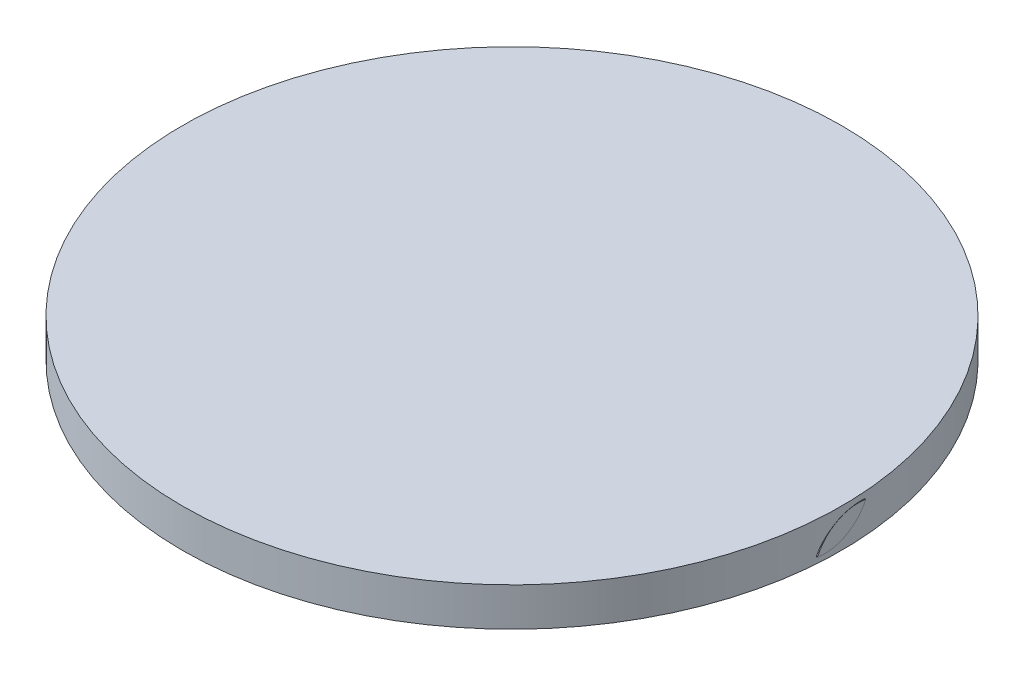
from build123d import *
from build123d.topology import SkipClean

# Parameters (mm, degrees)
SKETCH1_R               = 6.5
SKETCH1_R_2             = 2.5
BOSS_EXTRUDE1_DEPTH     = 7
BOSS_EXTRUDE2_START     = 4
BOSS_EXTRUDE2_DEPTH     = 56
CIRPATTERN1_COUNT       = 2
BODY_MOVE_COPY1_START   = -60
BODY_MOVE_COPY1_DEPTH   = 55.217817956
BODY_MOVE_COPY1_START_2 = 4.782182044
BODY_MOVE_COPY1_2_DEPTH = 55.217817956
BODY_MOVE_COPY1_3_DEPTH = 55.217817956
BODY_MOVE_COPY1_4_DEPTH = 55.217817956
BODY_MOVE_COPY1_START_3 = -1e-07
BODY_MOVE_COPY1_5_DEPTH = 7.0000002
SKETCH4_R               = 60
BOSS_EXTRUDE4_DEPTH     = 7


with BuildPart() as part:
    # Sketch1 → Boss-Extrude1 (new body)
    with BuildSketch(Plane(origin=(0, 0, 0), x_dir=(1, 0, 0), z_dir=(0, 1, 0))):
        with Locations(Location((0, 0, 0), (0, 0, 270))):
            Circle(SKETCH1_R)
        with Locations(Location((0, 0, 0), (0, 0, 270))):
            Circle(SKETCH1_R_2, mode=Mode.SUBTRACT)
    extrude(amount=BOSS_EXTRUDE1_DEPTH)

    # Sketch2 → Boss-Extrude2 (add)
    with BuildSketch(Plane(origin=(0, 0, 0), x_dir=(0, 0, -1), z_dir=(1, 0, 0)).offset(BOSS_EXTRUDE2_START)):
        with BuildLine():
            ThreePointArc((-4.4023555, 5.870499115), (0.805969699, 4.99680087), (4.4023555, 1.129500885))
            Line((4.4023555, 1.129500885), (-4.4023555, 5.870499115))
        make_face()
        with BuildLine():
            Line((-4.4023555, 5.870499115), (4.4023555, 1.129500885))
            ThreePointArc((4.4023555, 1.129500885), (-0.805969699, 2.00319913), (-4.4023555, 5.870499115))
        make_face()
    boss_extrude2 = extrude(amount=BOSS_EXTRUDE2_DEPTH)

    # CirPattern1: Boss-Extrude2 ×2 about axis
    cirpattern1_axis = Axis((0, 7.76683161, 0), (0, -1, 0))
    for i in range(1, CIRPATTERN1_COUNT):
        add(boss_extrude2.rotate(cirpattern1_axis, i * 360 / CIRPATTERN1_COUNT))

    # Body-Move/Copy1: read off the stored shape, not the designer's step
    # Body-Move/Copy1 outline → Body-Move/Copy1 (cut)
    with BuildSketch(Plane.YZ.offset(BODY_MOVE_COPY1_START)):
        with BuildLine():
            ThreePointArc((3.5, 2.791065672), (2.385672983, 3.701050486), (1.129500885, 4.4023555))
            ThreePointArc((1.129500885, 4.4023555), (1.074002125, 2.16715462), (1.624132962, 0))
            ThreePointArc((1.624132962, 0), (2.417503652, 1.492693089), (3.5, 2.791065672))
        make_face()
        with BuildLine():
            ThreePointArc((5.870499115, -4.4023555), (5.925997875, -2.16715462), (5.375867038, 0))
            ThreePointArc((5.375867038, 0), (4.582496348, -1.492693089), (3.5, -2.791065672))
            ThreePointArc((3.5, -2.791065672), (4.614327017, -3.701050486), (5.870499115, -4.4023555))
        make_face()
    extrude(amount=BODY_MOVE_COPY1_DEPTH, mode=Mode.SUBTRACT)

    # Body-Move_Copy1 2 outline → Body-Move_Copy1 2 (cut)
    with BuildSketch(Plane.YZ.offset(BODY_MOVE_COPY1_START_2)):
        with BuildLine():
            ThreePointArc((5.870499115, 4.4023555), (4.614327017, 3.701050486), (3.5, 2.791065672))
            ThreePointArc((3.5, 2.791065672), (4.582496348, 1.492693089), (5.375867038, 0))
            ThreePointArc((5.375867038, 0), (5.925997875, 2.16715462), (5.870499115, 4.4023555))
        make_face()
        with BuildLine():
            ThreePointArc((3.5, -2.791065672), (2.417503652, -1.492693089), (1.624132962, 0))
            ThreePointArc((1.624132962, 0), (1.074002125, -2.16715462), (1.129500885, -4.4023555))
            ThreePointArc((1.129500885, -4.4023555), (2.385672983, -3.701050486), (3.5, -2.791065672))
        make_face()
    extrude(amount=BODY_MOVE_COPY1_2_DEPTH, mode=Mode.SUBTRACT)

    # Body-Move_Copy1 3 outline → Body-Move_Copy1 3 (add)
    with BuildSketch(Plane.YZ.offset(BODY_MOVE_COPY1_START)):
        with BuildLine():
            ThreePointArc((5.870499115, 4.4023555), (4.614327017, 3.701050486), (3.5, 2.791065672))
            ThreePointArc((3.5, 2.791065672), (4.582496348, 1.492693089), (5.375867038, 0))
            ThreePointArc((5.375867038, 0), (5.925997875, 2.16715462), (5.870499115, 4.4023555))
        make_face()
        with BuildLine():
            ThreePointArc((3.5, -2.791065672), (2.417503652, -1.492693089), (1.624132962, 0))
            ThreePointArc((1.624132962, 0), (1.074002125, -2.16715462), (1.129500885, -4.4023555))
            ThreePointArc((1.129500885, -4.4023555), (2.385672983, -3.701050486), (3.5, -2.791065672))
        make_face()
    extrude(amount=BODY_MOVE_COPY1_3_DEPTH)

    # Body-Move_Copy1 4 outline → Body-Move_Copy1 4 (add)
    with BuildSketch(Plane.YZ.offset(BODY_MOVE_COPY1_START_2)):
        with BuildLine():
            ThreePointArc((3.5, 2.791065672), (2.385672983, 3.701050486), (1.129500885, 4.4023555))
            ThreePointArc((1.129500885, 4.4023555), (1.074002125, 2.16715462), (1.624132962, 0))
            ThreePointArc((1.624132962, 0), (2.417503652, 1.492693089), (3.5, 2.791065672))
        make_face()
        with BuildLine():
            ThreePointArc((5.870499115, -4.4023555), (5.925997875, -2.16715462), (5.375867038, 0))
            ThreePointArc((5.375867038, 0), (4.582496348, -1.492693089), (3.5, -2.791065672))
            ThreePointArc((3.5, -2.791065672), (4.614327017, -3.701050486), (5.870499115, -4.4023555))
        make_face()
    extrude(amount=BODY_MOVE_COPY1_4_DEPTH)

    # Body-Move_Copy1 5 outline → Body-Move_Copy1 5 (add)
    with SkipClean():  # the faces are left unmerged after this step: merging them gives an invalid solid
        with BuildSketch(Plane(origin=(0, 0, 0), x_dir=(1, 0, 0), z_dir=(0, 1, 0)).offset(BODY_MOVE_COPY1_START_3)):
            with BuildLine():
                ThreePointArc((4.782182098, -4.402355549), (6.5, 0), (4.782182098, 4.402355549))
                Line((4.782182098, 4.402355549), (4.782182098, -4.402355549))
            make_face()
            with BuildLine():
                Line((-4.782182098, -4.402355549), (-4.782182098, 4.402355549))
                ThreePointArc((-4.782182098, 4.402355549), (-6.5, 0), (-4.782182098, -4.402355549))
            make_face()
        extrude(amount=BODY_MOVE_COPY1_5_DEPTH)


with BuildPart() as body_2:
    # Sketch4 → Boss-Extrude4 (new body)
    with BuildSketch(Plane(origin=(0, 0, 0), x_dir=(1, 0, 0), z_dir=(0, 1, 0))):
        with Locations(Location((0, 0, 0), (0, 0, 270))):
            Circle(SKETCH4_R)
    extrude(amount=BOSS_EXTRUDE4_DEPTH)


solid = Compound([part.part, body_2.part])
